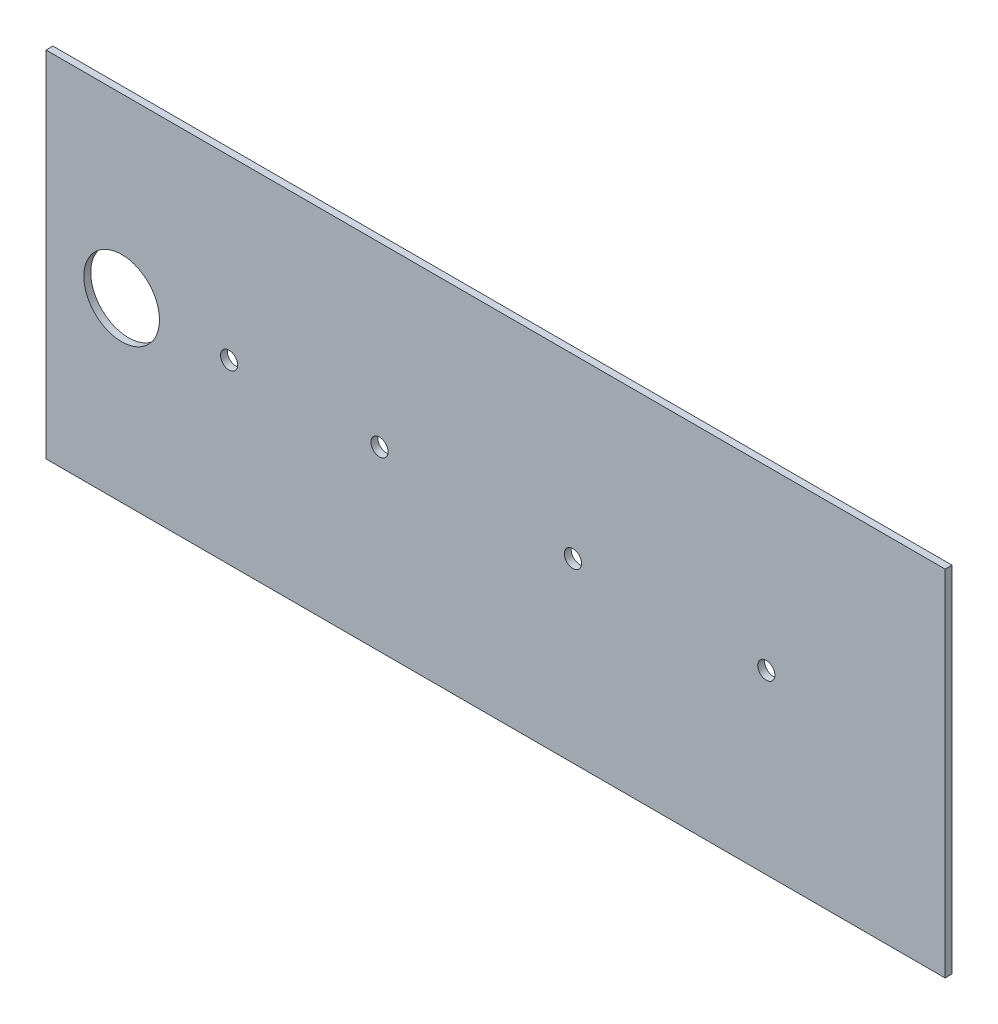
from build123d import *

# Parameters (mm, degrees)
SKETCH_1_W      = 261.5
SKETCH_1_H      = 103
SKETCH_1_R      = 2.5
SKETCH_1_R_2    = 11
EXTRUDE_1_DEPTH = 2


with BuildPart() as part:
    # Эскиз1 → Бобышка-Вытянуть1 (new body)
    with BuildSketch(Plane.XY):
        with Locations((130.75, 51.5)):
            Rectangle(SKETCH_1_W, SKETCH_1_H)
        with Locations((209.5, 51.5)):
            Circle(SKETCH_1_R, mode=Mode.SUBTRACT)
        with Locations((153.25, 51.5)):
            Circle(SKETCH_1_R, mode=Mode.SUBTRACT)
        with Locations((97, 51.5)):
            Circle(SKETCH_1_R, mode=Mode.SUBTRACT)
        with Locations((53.25, 51.5)):
            Circle(SKETCH_1_R, mode=Mode.SUBTRACT)
        with Locations((22, 51.5)):
            Circle(SKETCH_1_R_2, mode=Mode.SUBTRACT)
    extrude(amount=EXTRUDE_1_DEPTH)


solid = part.part
